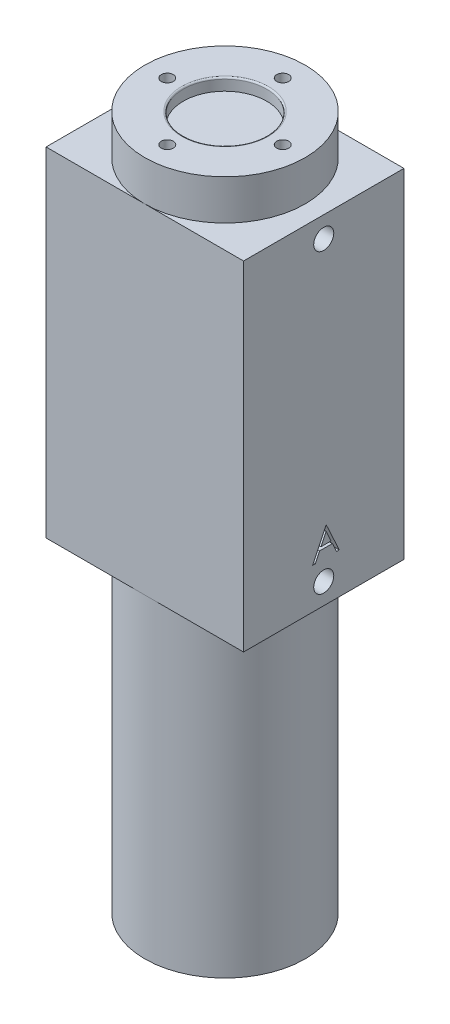
from build123d import *

# Parameters (mm, degrees)
FILLET1_R                 = 1
SKETCH2_R                 = 5.2
CUT_EXTRUDE1_DEPTH        = 1.5
FILLET2_R                 = 0.2
FILLET3_R                 = 5
CUT_EXTRUDE2_DEPTH        = 1
SKETCH6_R                 = 10
BOSS_EXTRUDE1_DEPTH       = 81.533333333
BOSS_EXTRUDE2_START       = -2.77
SKETCH8_W                 = 12.313661757
SKETCH8_H                 = 20
BOSS_EXTRUDE2_DEPTH       = 45
CUT_EXTRUDE5_DEPTH        = 2
CUT_EXTRUDE6_DEPTH        = 2
CUT_EXTRUDE_THIN1_START   = -10
SKETCH14_R                = 40
SKETCH14_R_2              = 10
CUT_EXTRUDE_THIN1_DEPTH   = 10
F_1_5MM_DOWEL_HOLE1_D     = 1.5
F_1_5MM_DOWEL_HOLE1_DEPTH = 12
F_1_5MM_DOWEL_HOLE1_TIP   = 0.450645464
F_2_5MM_DOWEL_HOLE1_D     = 2.5


with BuildPart() as part:
    # Sketch1 → Revolve1 (revolve)
    with BuildSketch(Plane(origin=(0, 0, 0), x_dir=(0, 0, -1), z_dir=(1, 0, 0))):
        Polygon((0, 0), (-30, 0), (-30, 7), (-20.102542457, 7), (-10.55, 7), (-10.55, 5), (0, 5), align=None)
    revolve(axis=Axis((0, 5, 0), (0, -1, 0)))

    # Fillet1
    fillet1_edges = [part.edges().sort_by_distance(p)[0] for p in [
        (0, 7, -10.55),
    ]]
    fillet(fillet1_edges, radius=FILLET1_R)

    # Sketch2 → Cut-Extrude1 (cut)
    with BuildSketch(Plane(origin=(0, 5, 0), x_dir=(1, 0, 0), z_dir=(0, 1, 0))):
        Circle(SKETCH2_R)
    extrude(amount=-CUT_EXTRUDE1_DEPTH, mode=Mode.SUBTRACT)

    # Fillet2
    fillet2_edges = [part.edges().sort_by_distance(p)[0] for p in [
        (-5.2, 5, 0),
    ]]
    fillet(fillet2_edges, radius=FILLET2_R)

    # Fillet3
    fillet3_edges = [part.edges().sort_by_distance(p)[0] for p in [
        (0, 7, -30),
    ]]
    fillet(fillet3_edges, radius=FILLET3_R)

    # Sketch4 → Cut-Extrude2 (cut)
    # profile 1 of 4: a face of its own
    with BuildSketch(Plane.XZ):
        Polygon((-0.644909543, 25.480704332), (0.002225874, 25.480704332), (0.002225874, 21.980704332), (-0.31187669, 21.980704332), (-0.31187669, 25.121729973), (-0.850338229, 25.121729973), align=None)
    # profile 2 of 4: a face of its own
    with BuildSketch(Plane.XZ):
        with BuildLine():
            Line((25.523815675, 2.292498481), (25.209713111, 2.292498481))
            add(Edge.make_bspline(
                [(25.209713111, 2.292498481), (25.211760264, 2.334169369), (25.215780818, 2.416009884), (25.234609107, 2.53533379), (25.261549984, 2.649388589), (25.299641438, 2.757258503), (25.346947716, 2.85989731), (25.403677743, 2.956897326), (25.470871594, 3.047888515), (25.547078328, 3.132027358), (25.629846967, 3.209214929), (25.719152906, 3.275870171), (25.812997934, 3.332187843), (25.911097333, 3.379269085), (26.014557896, 3.414608931), (26.122440754, 3.44083057), (26.23521989, 3.456606916), (26.312059912, 3.458302702), (26.351139393, 3.459165148)],
                knots=[0, 0, 0, 0, 1.10065271, 2.161652631, 3.183658789, 4.190468796, 5.17591951, 6.163126047, 7.15150782, 8.156236427, 9.156009102, 10.134482811, 11.092018607, 12.041330605, 13.001268258, 13.972401359, 14.968799086, 16, 16, 16, 16], degree=3))
            add(Edge.make_bspline(
                [(26.351139393, 3.459165148), (26.389517467, 3.458266692), (26.464929011, 3.456501257), (26.574991026, 3.441340228), (26.67976832, 3.417594636), (26.779056087, 3.38427922), (26.872062151, 3.339494792), (26.959485196, 3.285697254), (27.042366007, 3.223477422), (27.11697279, 3.150223609), (27.18548087, 3.072021224), (27.244583125, 2.988533321), (27.295196288, 2.902304035), (27.337383968, 2.812675833), (27.368440107, 2.718804805), (27.392018315, 2.622057602), (27.405345729, 2.521432791), (27.407391152, 2.453326236), (27.408431059, 2.418700405)],
                knots=[0, 0, 0, 0, 1.111607364, 2.184268762, 3.212621178, 4.221274766, 5.211760367, 6.196651075, 7.1921475, 8.207485113, 9.220403448, 10.201281604, 11.166441695, 12.114753415, 13.065576456, 14.026450734, 14.996634279, 16, 16, 16, 16], degree=3))
            add(Edge.make_bspline(
                [(27.408431059, 2.418700405), (27.406744414, 2.369950595), (27.403400723, 2.273306467), (27.37454502, 2.13110211), (27.329962923, 1.99319705), (27.275889894, 1.882217998), (27.221269326, 1.793241105), (27.17308953, 1.719325464), (27.115437178, 1.640499047), (27.048839764, 1.555967938), (26.974301958, 1.465473568), (26.89128729, 1.368978802), (26.7991616, 1.267508497), (26.734503418, 1.198202684), (26.700999168, 1.162290148)],
                knots=[0, 0, 0, 0, 1.184203166, 2.347625244, 3.513805382, 4.700623107, 5.337941753, 6.051866363, 6.845199593, 7.711357327, 8.668078039, 9.695487809, 10.805859518, 12, 12, 12, 12], degree=3))
            Line((26.700999168, 1.162290148), (25.825298046, 0.228395917))
            Line((25.825298046, 0.228395917), (27.453302854, 0.228395917))
            Line((27.453302854, 0.228395917), (27.453302854, -0.130578442))
            Line((27.453302854, -0.130578442), (25.075097726, -0.130578442))
            Line((25.075097726, -0.130578442), (26.432469521, 1.317939187))
            add(Edge.make_bspline(
                [(26.432469521, 1.317939187), (26.465517408, 1.352437493), (26.528995635, 1.41870168), (26.618778212, 1.51544464), (26.6994172, 1.605194181), (26.771434593, 1.687780729), (26.833268098, 1.764412297), (26.88814033, 1.832607), (26.932105921, 1.895361451), (26.979821317, 1.968102065), (27.026035298, 2.056914382), (27.065747654, 2.165448071), (27.089962502, 2.277175324), (27.092867338, 2.352677361), (27.094328495, 2.390655533)],
                knots=[0, 0, 0, 0, 1.329631726, 2.553950428, 3.673215718, 4.687767853, 5.603093632, 6.413772471, 7.123043292, 7.734684054, 8.834405432, 9.900288307, 10.943827018, 12, 12, 12, 12], degree=3))
            add(Edge.make_bspline(
                [(27.094328495, 2.390655533), (27.093692753, 2.414536931), (27.092439827, 2.461602582), (27.081382129, 2.530608341), (27.064671623, 2.597173154), (27.040726365, 2.661501774), (27.009119625, 2.722947426), (26.970646245, 2.781584906), (26.926256182, 2.838273871), (26.874904912, 2.891427169), (26.818493393, 2.940108375), (26.758899143, 2.98323246), (26.695849039, 3.019271571), (26.629608917, 3.048815068), (26.560363447, 3.071990449), (26.487978702, 3.088049029), (26.412654686, 3.098131512), (26.36122119, 3.099495684), (26.335013591, 3.100190789)],
                knots=[0, 0, 0, 0, 0.991446411, 1.95395049, 2.89581595, 3.838931463, 4.798493298, 5.75982156, 6.748411868, 7.785213223, 8.824556874, 9.840280684, 10.836137867, 11.835679398, 12.848801643, 13.863922112, 14.911575587, 16, 16, 16, 16], degree=3))
            add(Edge.make_bspline(
                [(26.335013591, 3.100190789), (26.307642759, 3.099475757), (26.253890962, 3.098071552), (26.174971929, 3.088248888), (26.099686152, 3.071303047), (26.027844249, 3.048126373), (25.959324663, 3.018667824), (25.894460619, 2.981976079), (25.83339773, 2.938192586), (25.776021206, 2.88855203), (25.723157227, 2.833284429), (25.676710352, 2.771674466), (25.636126337, 2.70484705), (25.600717104, 2.6329825), (25.571961414, 2.55542872), (25.549988263, 2.472461015), (25.532601417, 2.384439633), (25.526792896, 2.323654549), (25.523815675, 2.292498481)],
                knots=[0, 0, 0, 0, 1.031018746, 2.02475058, 2.990194455, 3.934040569, 4.864654155, 5.795059489, 6.735614925, 7.690564532, 8.649604399, 9.611025574, 10.590972636, 11.591080095, 12.624614302, 13.701020113, 14.821632451, 16, 16, 16, 16], degree=3))
        make_face()
    # profile 3 of 4: a face of its own
    with BuildSketch(Plane.XZ):
        with BuildLine():
            Line((0.191598009, -25.382057247), (-0.122504556, -25.382057247))
            add(Edge.make_bspline(
                [(-0.122504556, -25.382057247), (-0.113995005, -25.346824763), (-0.097359529, -25.277948138), (-0.062661956, -25.179540878), (-0.024862701, -25.086417356), (0.020526404, -25.000321283), (0.070035158, -24.91952238), (0.12675788, -24.845853255), (0.188077602, -24.77744029), (0.255902552, -24.716727052), (0.327031213, -24.661749323), (0.402465833, -24.614874266), (0.480688727, -24.574550113), (0.56224186, -24.541329881), (0.647368031, -24.516304357), (0.735297655, -24.498147552), (0.826261155, -24.486356438), (0.888008745, -24.485205674), (0.919362432, -24.484621349)],
                knots=[0, 0, 0, 0, 1.162005537, 2.271625781, 3.343758855, 4.383309926, 5.390229558, 6.379919256, 7.361854164, 8.333198761, 9.295911338, 10.242430842, 11.177959212, 12.116337295, 13.062827104, 14.020064771, 14.994644689, 16, 16, 16, 16], degree=3))
            add(Edge.make_bspline(
                [(0.919362432, -24.484621349), (0.965045174, -24.48600058), (1.055414185, -24.488728955), (1.188177232, -24.513643392), (1.316204051, -24.553068524), (1.438093299, -24.607542251), (1.551311731, -24.674729564), (1.652047918, -24.754694301), (1.738936429, -24.845893603), (1.811830806, -24.946626167), (1.868905805, -25.054281676), (1.910992179, -25.165081833), (1.93661386, -25.278763805), (1.939934417, -25.355521084), (1.941598009, -25.393976317)],
                knots=[0, 0, 0, 0, 1.083050992, 2.142477498, 3.193116406, 4.255571735, 5.30263384, 6.308962982, 7.297363603, 8.282367274, 9.249857812, 10.179914175, 11.08814088, 12, 12, 12, 12], degree=3))
            add(Edge.make_bspline(
                [(1.941598009, -25.393976317), (1.940434418, -25.430983112), (1.93815745, -25.503399667), (1.918823745, -25.609121164), (1.886287482, -25.708762764), (1.841217719, -25.802743926), (1.782876169, -25.890468766), (1.712203472, -25.972134657), (1.628700811, -26.048103815), (1.565421872, -26.091623288), (1.532844002, -26.114028401)],
                knots=[0, 0, 0, 0, 1.024540389, 2.004866551, 2.965041327, 3.920577974, 4.882998113, 5.874504559, 6.905732034, 8, 8, 8, 8], degree=3))
            add(Edge.make_bspline(
                [(1.532844002, -26.114028401), (1.570075757, -26.132006572), (1.643842631, -26.16762653), (1.744393161, -26.237482287), (1.835671036, -26.318138635), (1.886574755, -26.381081288), (1.912150893, -26.412706285)],
                knots=[0, 0, 0, 0, 1.015518401, 2.012035669, 3.001164323, 4, 4, 4, 4], degree=3))
            add(Edge.make_bspline(
                [(1.912150893, -26.412706285), (1.928992236, -26.435764037), (1.962399132, -26.481501953), (2.003634665, -26.555038379), (2.04104378, -26.629389869), (2.070193999, -26.706549275), (2.092767866, -26.785622288), (2.108903898, -26.866744684), (2.118928039, -26.949982707), (2.120363591, -27.006295187), (2.121085188, -27.034601317)],
                knots=[0, 0, 0, 0, 1.025084078, 2.033381695, 3.024893161, 4.013698104, 4.991890475, 5.976764909, 6.982997093, 8, 8, 8, 8], degree=3))
            add(Edge.make_bspline(
                [(2.121085188, -27.034601317), (2.119290675, -27.083611039), (2.115710093, -27.18139984), (2.083706018, -27.325874562), (2.034092778, -27.467100064), (1.963635842, -27.602174904), (1.877768333, -27.728555285), (1.775611009, -27.841631594), (1.6583246, -27.938830198), (1.527518951, -28.020040426), (1.385801823, -28.084958348), (1.234226231, -28.130015791), (1.074976177, -28.159361791), (0.965768879, -28.16250866), (0.910247848, -28.164108529)],
                knots=[0, 0, 0, 0, 0.955779014, 1.907060117, 2.875433937, 3.871313158, 4.872415639, 5.851225146, 6.836215519, 7.83643374, 8.849228613, 9.86973379, 10.916971861, 12, 12, 12, 12], degree=3))
            add(Edge.make_bspline(
                [(0.910247848, -28.164108529), (0.872828548, -28.163240316), (0.799199843, -28.161531961), (0.690956345, -28.14985336), (0.587634645, -28.128523355), (0.489095047, -28.09982005), (0.395250011, -28.063428308), (0.306385906, -28.01810961), (0.221956012, -27.964798108), (0.142757061, -27.90286452), (0.068798493, -27.83358318), (0.002045769, -27.75572417), (-0.058614024, -27.670726766), (-0.111556662, -27.57760371), (-0.159193615, -27.477558453), (-0.198374572, -27.369309954), (-0.23286014, -27.253825932), (-0.248893605, -27.173348192), (-0.25711994, -27.132057247)],
                knots=[0, 0, 0, 0, 1.048658725, 2.063410685, 3.046034179, 4.001477787, 4.936774919, 5.862367409, 6.792675028, 7.730719943, 8.675894397, 9.627829632, 10.600096036, 11.597688215, 12.626045268, 13.701542398, 14.82072376, 16, 16, 16, 16], degree=3))
            Line((-0.25711994, -27.132057247), (0.056982624, -27.132057247))
            add(Edge.make_bspline(
                [(0.056982624, -27.132057247), (0.065165915, -27.15900626), (0.081083128, -27.211424432), (0.108177426, -27.286864737), (0.139045698, -27.356022791), (0.172160257, -27.419405913), (0.206938703, -27.477638315), (0.245853628, -27.529180184), (0.286022773, -27.576295386), (0.316302126, -27.602839998), (0.331121246, -27.615831285)],
                knots=[0, 0, 0, 0, 1.198163088, 2.33053128, 3.407730985, 4.417276592, 5.372219308, 6.28897303, 7.162600585, 8, 8, 8, 8], degree=3))
            add(Edge.make_bspline(
                [(0.331121246, -27.615831285), (0.350717822, -27.630939619), (0.389850485, -27.661109651), (0.453618716, -27.69961128), (0.520683602, -27.732972305), (0.592498277, -27.758456001), (0.667513047, -27.780033661), (0.746940412, -27.79415418), (0.830079629, -27.803842352), (0.886847393, -27.804697283), (0.915856823, -27.80513417)],
                knots=[0, 0, 0, 0, 0.946170439, 1.889420265, 2.845303464, 3.807233317, 4.801018734, 5.828864929, 6.890507805, 8, 8, 8, 8], degree=3))
            add(Edge.make_bspline(
                [(0.915856823, -27.80513417), (0.948610325, -27.804518265), (1.012656972, -27.803313915), (1.106111832, -27.792238208), (1.195019279, -27.776107795), (1.278392205, -27.751194812), (1.357322712, -27.720413961), (1.430704362, -27.681765555), (1.499500468, -27.636420833), (1.562829874, -27.584881675), (1.619775381, -27.52846018), (1.669914894, -27.469447109), (1.712539556, -27.408091279), (1.746923134, -27.344053158), (1.774073684, -27.277597929), (1.792556885, -27.2085391), (1.8054084, -27.137441834), (1.806455012, -27.089112865), (1.806982624, -27.064749555)],
                knots=[0, 0, 0, 0, 1.217147791, 2.380027433, 3.494444702, 4.572153297, 5.609568379, 6.639424714, 7.649109417, 8.668170816, 9.669597737, 10.625200337, 11.543417969, 12.441394052, 13.322311151, 14.205496177, 15.095365482, 16, 16, 16, 16], degree=3))
            add(Edge.make_bspline(
                [(1.806982624, -27.064749555), (1.805452322, -27.032138216), (1.802399334, -26.967077807), (1.779090755, -26.871360233), (1.74075189, -26.779136821), (1.687079379, -26.691981031), (1.62174365, -26.611205129), (1.545378744, -26.539133647), (1.457350515, -26.479663556), (1.376330646, -26.438574899), (1.30456549, -26.410537824), (1.243150105, -26.39186286), (1.174393502, -26.376049204), (1.099127153, -26.361336932), (1.016783936, -26.348815584), (0.927453498, -26.338373768), (0.831117737, -26.330018727), (0.764426571, -26.326287632), (0.730059547, -26.324364939)],
                knots=[0, 0, 0, 0, 1.07054697, 2.135767047, 3.216561865, 4.33974944, 5.486079747, 6.621378074, 7.775625952, 8.963672916, 9.598146892, 10.304877434, 11.070270905, 11.915000392, 12.823868403, 13.805723172, 14.86925407, 16, 16, 16, 16], degree=3))
            Line((0.730059547, -26.324364939), (0.730059547, -25.96539058))
            add(Edge.make_bspline(
                [(0.730059547, -25.96539058), (0.773360713, -25.964655776), (0.858177059, -25.963216476), (0.982071364, -25.945808466), (1.100544676, -25.921727838), (1.210971418, -25.884842646), (1.311620132, -25.842002349), (1.398939734, -25.792150139), (1.471706881, -25.73673539), (1.529567952, -25.674902781), (1.573097181, -25.608587733), (1.604923979, -25.539471076), (1.623724305, -25.466947015), (1.626233972, -25.417452347), (1.627495444, -25.392574074)],
                knots=[0, 0, 0, 0, 1.321986639, 2.589447074, 3.816329219, 5.01088745, 6.139805852, 7.153945165, 8.075214402, 8.924034688, 9.728124013, 10.488707548, 11.240355623, 12, 12, 12, 12], degree=3))
            add(Edge.make_bspline(
                [(1.627495444, -25.392574074), (1.627081034, -25.374296329), (1.626256583, -25.337933622), (1.615859305, -25.284808553), (1.600235264, -25.233307607), (1.578755535, -25.183649797), (1.550005336, -25.136179523), (1.515599349, -25.090492074), (1.474631249, -25.046848295), (1.427685802, -25.006167975), (1.377273997, -24.967398738), (1.322024222, -24.934485101), (1.263602347, -24.906340039), (1.201943692, -24.883130537), (1.136848162, -24.865671249), (1.068621604, -24.853135407), (0.997133921, -24.845297753), (0.948362189, -24.844169337), (0.923569162, -24.843595708)],
                knots=[0, 0, 0, 0, 0.884392785, 1.759457502, 2.611959086, 3.489218968, 4.37281399, 5.2945488, 6.255912374, 7.266815255, 8.301784654, 9.332968512, 10.37626691, 11.440494194, 12.520033166, 13.637162961, 14.798855837, 16, 16, 16, 16], degree=3))
            add(Edge.make_bspline(
                [(0.923569162, -24.843595708), (0.883717494, -24.84498707), (0.805877918, -24.847704724), (0.693663001, -24.871507737), (0.589343667, -24.909485821), (0.509605001, -24.95481884), (0.450722426, -24.999569274), (0.408645488, -25.038651661), (0.367324978, -25.082084484), (0.329479301, -25.13254286), (0.291205324, -25.18660965), (0.256360763, -25.247033331), (0.22250107, -25.312237726), (0.202098521, -25.35833336), (0.191598009, -25.382057247)],
                knots=[0, 0, 0, 0, 1.472543308, 2.876219568, 4.221790263, 5.565193594, 6.249813518, 6.953379497, 7.687249741, 8.463570142, 9.283606569, 10.136032583, 11.040678096, 12, 12, 12, 12], degree=3))
        make_face()
    # profile 4 of 4: a face of its own
    with BuildSketch(Plane.XZ):
        Polygon((-24.84722085, 3.262784403), (-24.783418767, 3.262784403), (-24.783418767, 0.83970748), (-24.379572613, 0.83970748), (-24.379572613, 0.480733121), (-24.783418767, 0.480733121), (-24.783418767, -0.326959187), (-25.097521331, -0.326959187), (-25.097521331, 0.480733121), (-26.757777741, 0.480733121), align=None)
        Polygon((-25.097521331, 0.83970748), (-25.097521331, 2.358337287), (-26.14008944, 0.83970748), align=None, mode=Mode.SUBTRACT)
    extrude(amount=-CUT_EXTRUDE2_DEPTH, mode=Mode.SUBTRACT)

    # Sketch6 → Boss-Extrude1 (add)
    with BuildSketch(Plane.XZ):
        Circle(SKETCH6_R)
    extrude(amount=BOSS_EXTRUDE1_DEPTH)

    # Sketch8 → Boss-Extrude2 (add)
    with BuildSketch(Plane(origin=(0, 0, 0), x_dir=(-1, 0, 0), z_dir=(0, -1, 0)).offset(BOSS_EXTRUDE2_START)):
        with Locations((-6.156830879, 0)):
            Rectangle(SKETCH8_W, SKETCH8_H)
        with BuildLine():
            Line((12.313661757, 10), (0, 10))
            ThreePointArc((0, 10), (10, 0), (0, -10))
            Line((0, -10), (12.313661757, -10))
            Line((12.313661757, -10), (12.313661757, 10))
        make_face()
    extrude(amount=BOSS_EXTRUDE2_DEPTH)

    # Sketch12 → Cut-Extrude5 (cut)
    with BuildSketch(Plane(origin=(12.313661757, 0, 0), x_dir=(0, 0, -1), z_dir=(1, 0, 0))):
        Polygon((0.322889874, -33.675221664), (1.93827449, -37.175221664), (1.596828176, -37.175221664), (1.079400291, -36.053426792), (-0.507238331, -36.053426792), (-1.038688651, -37.175221664), (-1.382238331, -37.175221664), (0.278018079, -33.675221664), align=None)
        Polygon((0.296948368, -34.358114292), (-0.336164613, -35.694452433), (0.913935547, -35.694452433), align=None, mode=Mode.SUBTRACT)
    extrude(amount=-CUT_EXTRUDE5_DEPTH, mode=Mode.SUBTRACT)

    # Sketch13 → Cut-Extrude6 (cut)
    with BuildSketch(Plane.ZY.offset(12.313661757)):
        with BuildLine():
            Line((-0.99287483, -31.753097959), (-0.309982202, -31.753097959))
            add(Edge.make_bspline(
                [(-0.309982202, -31.753097959), (-0.276553724, -31.753273709), (-0.211761013, -31.753614357), (-0.117541571, -31.758897488), (-0.029292761, -31.766101158), (0.053011011, -31.777531251), (0.129331714, -31.791323028), (0.199899351, -31.808024844), (0.264489523, -31.828051458), (0.34160226, -31.859897739), (0.429522921, -31.907220907), (0.524721313, -31.977149472), (0.606125553, -32.062681935), (0.67631187, -32.159164591), (0.73211299, -32.265300363), (0.772482287, -32.378559551), (0.798040162, -32.497481293), (0.800668596, -32.579124471), (0.801996965, -32.620385619)],
                knots=[0, 0, 0, 0, 1.001505555, 1.941167018, 2.826882275, 3.653841531, 4.429895133, 5.150066043, 5.825578002, 6.45369114, 7.647487171, 8.808567382, 9.977351308, 11.170798116, 12.373658725, 13.556498008, 14.765093433, 16, 16, 16, 16], degree=3))
            add(Edge.make_bspline(
                [(0.801996965, -32.620385619), (0.800903746, -32.659038175), (0.798755469, -32.734994092), (0.77821271, -32.846088201), (0.746052041, -32.95183942), (0.701346792, -33.051861805), (0.643244796, -33.143895418), (0.574386477, -33.228682684), (0.491309675, -33.302633741), (0.429066435, -33.343976644), (0.397449689, -33.364976965)],
                knots=[0, 0, 0, 0, 1.044552857, 2.05264487, 3.044412934, 4.028983338, 5.005914585, 5.980388656, 6.974128949, 8, 8, 8, 8], degree=3))
            add(Edge.make_bspline(
                [(0.397449689, -33.364976965), (0.437210117, -33.380241964), (0.513281664, -33.409447688), (0.617967677, -33.461083152), (0.708162522, -33.517245263), (0.784559668, -33.578577113), (0.849897322, -33.644685924), (0.906950264, -33.716541038), (0.955631638, -33.795079796), (0.997344562, -33.879483331), (1.029893318, -33.9688898), (1.054269222, -34.062460576), (1.068236671, -34.159860131), (1.070224313, -34.22614551), (1.071227734, -34.259608375)],
                knots=[0, 0, 0, 0, 1.27268992, 2.434971085, 3.483601985, 4.442670788, 5.356604649, 6.2567628, 7.179492994, 8.113709626, 9.066344395, 10.018646069, 10.999752585, 12, 12, 12, 12], degree=3))
            add(Edge.make_bspline(
                [(1.071227734, -34.259608375), (1.070250888, -34.293775247), (1.068328916, -34.360999526), (1.054148944, -34.45975466), (1.030139837, -34.554129607), (0.997068691, -34.644734789), (0.953906376, -34.731394924), (0.901378412, -34.814208188), (0.838746848, -34.892342518), (0.768683979, -34.966666142), (0.689421834, -35.033493929), (0.603906079, -35.093009636), (0.511059759, -35.141955698), (0.412407765, -35.183071719), (0.306843449, -35.214478918), (0.194840842, -35.236451492), (0.07649654, -35.251256529), (-0.004713211, -35.252473733), (-0.046360407, -35.253097959)],
                knots=[0, 0, 0, 0, 0.978564426, 1.925352924, 2.850884081, 3.763762016, 4.682927383, 5.618979971, 6.567305752, 7.547517671, 8.540179244, 9.531824382, 10.526200242, 11.540722885, 12.589160233, 13.674978461, 14.80764778, 16, 16, 16, 16], degree=3))
            Line((-0.046360407, -35.253097959), (-0.99287483, -35.253097959))
            Line((-0.99287483, -35.253097959), (-0.99287483, -31.753097959))
        make_face()
        with BuildLine():
            Line((-0.678772266, -32.112072318), (-0.678772266, -33.233867189))
            Line((-0.678772266, -33.233867189), (-0.467734606, -33.233867189))
            add(Edge.make_bspline(
                [(-0.467734606, -33.233867189), (-0.43688581, -33.233467266), (-0.377279651, -33.232694534), (-0.290959755, -33.230481017), (-0.210834736, -33.224282973), (-0.137042903, -33.218086711), (-0.069700459, -33.208012123), (-0.008956598, -33.196020001), (0.046141999, -33.183337095), (0.109681545, -33.161767609), (0.181754493, -33.129889933), (0.258587597, -33.080418097), (0.326322067, -33.021493744), (0.383519255, -32.953502782), (0.430330725, -32.878636596), (0.46284444, -32.798089716), (0.484891724, -32.713869584), (0.486883256, -32.656051331), (0.487894401, -32.626695715)],
                knots=[0, 0, 0, 0, 1.156816544, 2.235205308, 3.236616184, 4.169592532, 5.011045266, 5.787822928, 6.49130361, 7.128639758, 8.301311294, 9.436451833, 10.541879658, 11.654887649, 12.756523258, 13.837046038, 14.901820046, 16, 16, 16, 16], degree=3))
            add(Edge.make_bspline(
                [(0.487894401, -32.626695715), (0.487368221, -32.607269944), (0.486336061, -32.569164171), (0.477882758, -32.513614817), (0.463515184, -32.461371065), (0.44506089, -32.411716954), (0.419272202, -32.366205104), (0.388908738, -32.323261909), (0.352223048, -32.28434979), (0.310465735, -32.247980292), (0.262457113, -32.215735764), (0.208225821, -32.187495001), (0.147038144, -32.164754224), (0.079925289, -32.144838072), (0.005854201, -32.130849778), (-0.074320352, -32.11919639), (-0.161255071, -32.113263648), (-0.221400174, -32.112478285), (-0.252490215, -32.112072318)],
                knots=[0, 0, 0, 0, 0.91205012, 1.789085906, 2.630437955, 3.453916878, 4.269457761, 5.079663411, 5.91843418, 6.774407191, 7.675494373, 8.627863946, 9.638891023, 10.736472738, 11.911756761, 13.175263542, 14.539845004, 16, 16, 16, 16], degree=3))
            Line((-0.252490215, -32.112072318), (-0.678772266, -32.112072318))
        make_face(mode=Mode.SUBTRACT)
        with BuildLine():
            Line((-0.678772266, -33.592841548), (-0.678772266, -34.8941236))
            Line((-0.678772266, -34.8941236), (-0.231456561, -34.8941236))
            add(Edge.make_bspline(
                [(-0.231456561, -34.8941236), (-0.199437635, -34.893739852), (-0.137725376, -34.89300023), (-0.048624146, -34.890585675), (0.033958958, -34.885093399), (0.109647093, -34.87644755), (0.179257546, -34.867069101), (0.241955249, -34.85445782), (0.298248442, -34.840008859), (0.36352275, -34.817674687), (0.437026258, -34.782978216), (0.516237115, -34.73066399), (0.586663333, -34.668340682), (0.646468592, -34.596209768), (0.695481581, -34.517778441), (0.731137036, -34.434633091), (0.753127893, -34.348147563), (0.755790062, -34.289180851), (0.75712517, -34.259608375)],
                knots=[0, 0, 0, 0, 1.160039823, 2.235823828, 3.228722157, 4.157150951, 4.99529583, 5.772374946, 6.472645482, 7.099169577, 8.269452708, 9.405989375, 10.527446681, 11.663510218, 12.788923519, 13.866172445, 14.929861265, 16, 16, 16, 16], degree=3))
            add(Edge.make_bspline(
                [(0.75712517, -34.259608375), (0.756849066, -34.241115035), (0.756301311, -34.204426653), (0.748040696, -34.150510834), (0.736026826, -34.098284961), (0.720495392, -34.04760722), (0.697875925, -33.999393844), (0.67146938, -33.952691284), (0.640507978, -33.907437805), (0.592263812, -33.850225551), (0.522091828, -33.784308538), (0.422385052, -33.719771036), (0.309012754, -33.667723229), (0.226785261, -33.645623753), (0.184308664, -33.634207734)],
                knots=[0, 0, 0, 0, 0.723448775, 1.435228256, 2.130040452, 2.821711965, 3.505591119, 4.210454504, 4.921174351, 5.648778258, 7.137944449, 8.670945889, 10.280296675, 12, 12, 12, 12], degree=3))
            add(Edge.make_bspline(
                [(0.184308664, -33.634207734), (0.167279568, -33.63075265), (0.130356975, -33.623261316), (0.070149395, -33.615353612), (0.001413526, -33.608308552), (-0.076009351, -33.603097395), (-0.162217192, -33.597710851), (-0.257394111, -33.59561603), (-0.361151426, -33.59311677), (-0.433143798, -33.592935636), (-0.470539093, -33.592841548)],
                knots=[0, 0, 0, 0, 0.634451884, 1.375622551, 2.216452059, 3.157844607, 4.20941857, 5.370758133, 6.634282058, 8, 8, 8, 8], degree=3))
            Line((-0.470539093, -33.592841548), (-0.678772266, -33.592841548))
        make_face(mode=Mode.SUBTRACT)
    extrude(amount=-CUT_EXTRUDE6_DEPTH, mode=Mode.SUBTRACT)

    # Sketch14 → Cut-Extrude-Thin1 (cut)
    with BuildSketch(Plane.XZ.offset(CUT_EXTRUDE_THIN1_START)):
        Circle(SKETCH14_R)
        Circle(SKETCH14_R_2, mode=Mode.SUBTRACT)
    extrude(amount=CUT_EXTRUDE_THIN1_DEPTH, mode=Mode.SUBTRACT)

    # Ø1.5mm Dowel Hole1
    with Locations(Plane(origin=(0, 5, 0), x_dir=(1, 0, 0), z_dir=(0, 1, 0))):
        with Locations((-7.2, 0), (0, 7.2), (7.2, 0), (0, -7.2)):
            Hole(F_1_5MM_DOWEL_HOLE1_D / 2, depth=F_1_5MM_DOWEL_HOLE1_DEPTH)
            with Locations((0, 0, -(F_1_5MM_DOWEL_HOLE1_DEPTH + F_1_5MM_DOWEL_HOLE1_TIP / 2))):  # 118° drill point
                Cone(0, F_1_5MM_DOWEL_HOLE1_D / 2, F_1_5MM_DOWEL_HOLE1_TIP, mode=Mode.SUBTRACT)

    # Ø2.5mm Dowel Hole1 (through all)
    with Locations(Plane(origin=(12.313661757, 0, 0), x_dir=(0, 0, -1), z_dir=(1, 0, 0))):
        with Locations((0, -2.615), (0, -39.615)):
            Hole(F_2_5MM_DOWEL_HOLE1_D / 2)


solid = part.part
